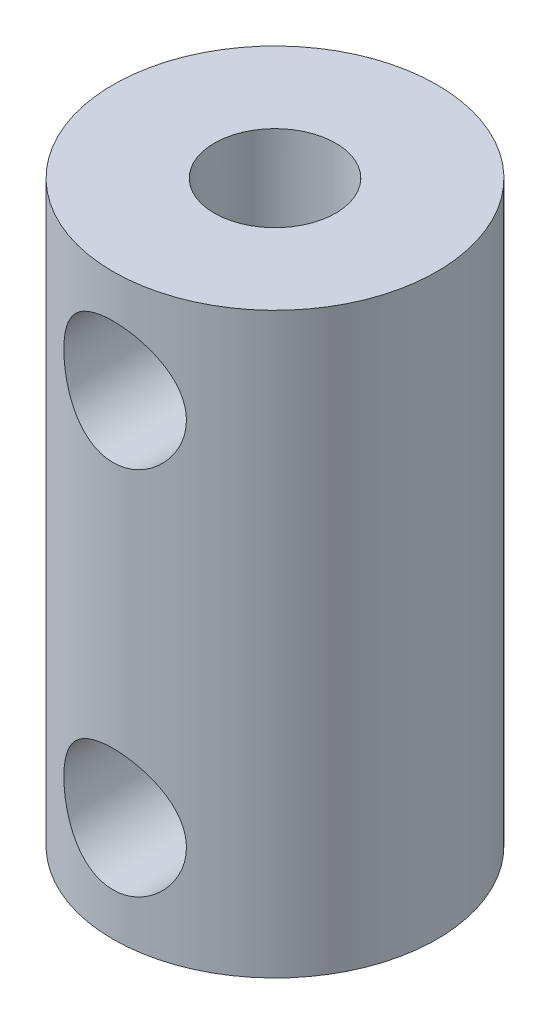
from build123d import *

# Parameters (mm, degrees)
SKETCH1_R                       = 5.334
BOSS_EXTRUDE1_DEPTH             = 19.05
F_4_0MM_DOWEL_HOLE2_D           = 4
F_4_0MM_DOWEL_HOLE2_DEPTH       = 9.525
F_4_0MM_DOWEL_HOLE2_TIP         = 1.201721238
F_3_16_0_1875_DOWEL_HOLE1_D     = 4.7625
F_3_16_0_1875_DOWEL_HOLE1_DEPTH = 9.525
F_3_16_0_1875_DOWEL_HOLE1_TIP   = 1.430799349
F_10_32_TAPPED_HOLE1_OUTLINE_R  = 2.0193
F_10_32_TAPPED_HOLE1_DEPTH      = 6


with BuildPart() as part:
    # Sketch1 → Boss-Extrude1 (new body)
    with BuildSketch(Plane(origin=(0, 0, 0), x_dir=(1, 0, 0), z_dir=(0, 1, 0))):
        with Locations(Location((0, 0, 0), (0, 0, 90))):
            Circle(SKETCH1_R)
    extrude(amount=BOSS_EXTRUDE1_DEPTH)

    # Ø4.0mm Dowel Hole2
    with Locations(Plane(origin=(0, 19.05, 0), x_dir=(1, 0, 0), z_dir=(0, 1, 0))):
        with Locations((0, 0)):
            Hole(F_4_0MM_DOWEL_HOLE2_D / 2, depth=F_4_0MM_DOWEL_HOLE2_DEPTH)
            with Locations((0, 0, -(F_4_0MM_DOWEL_HOLE2_DEPTH + F_4_0MM_DOWEL_HOLE2_TIP / 2))):  # 118° drill point
                Cone(0, F_4_0MM_DOWEL_HOLE2_D / 2, F_4_0MM_DOWEL_HOLE2_TIP, mode=Mode.SUBTRACT)

    # 3/16 (0.1875) Dowel Hole1
    with Locations(Plane(origin=(0, 0, 0), x_dir=(-1, 0, 0), z_dir=(0, -1, 0))):
        with Locations((0, 0)):
            Hole(F_3_16_0_1875_DOWEL_HOLE1_D / 2, depth=F_3_16_0_1875_DOWEL_HOLE1_DEPTH)
            with Locations((0, 0, -(F_3_16_0_1875_DOWEL_HOLE1_DEPTH + F_3_16_0_1875_DOWEL_HOLE1_TIP / 2))):  # 118° drill point
                Cone(0, F_3_16_0_1875_DOWEL_HOLE1_D / 2, F_3_16_0_1875_DOWEL_HOLE1_TIP, mode=Mode.SUBTRACT)

    # #10-32 Tapped Hole1: read off the stored shape, not the designer's step
    # #10-32 Tapped Hole1 outline → #10-32 Tapped Hole1 (cut)
    with BuildSketch(Plane.XY):
        with Locations((0, 3.429)):
            Circle(F_10_32_TAPPED_HOLE1_OUTLINE_R)
        with Locations((0, 15.621)):
            Circle(F_10_32_TAPPED_HOLE1_OUTLINE_R)
    extrude(amount=F_10_32_TAPPED_HOLE1_DEPTH, mode=Mode.SUBTRACT)


solid = part.part
